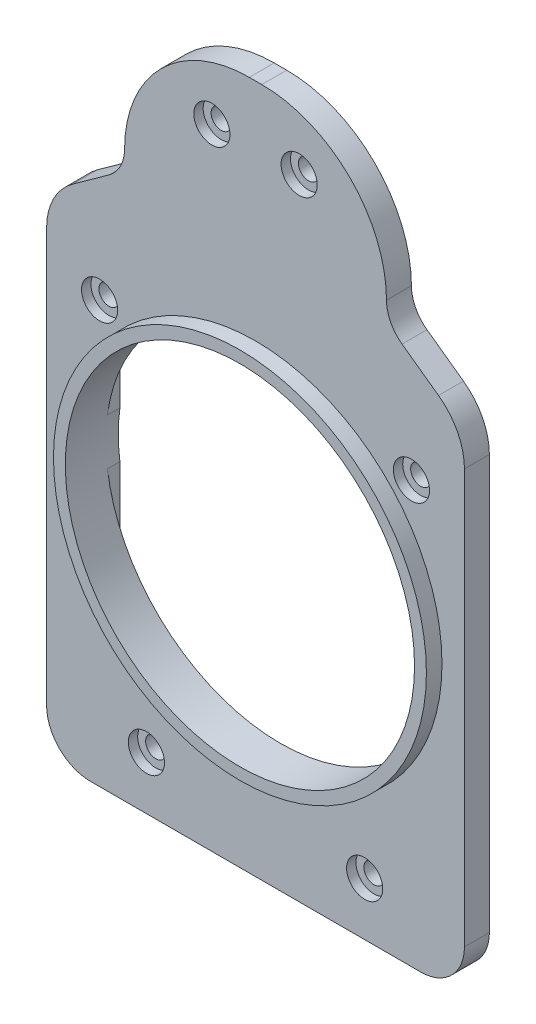
from build123d import *

# Parameters (mm, degrees)
ESBO_O1_W                = 67
ESBO_O1_H                = 110.5
RESSALTO_EXTRUS_O1_DEPTH = 4
CORTE_EXTRUS_O4_DEPTH    = 75.123208241
FILETE5_R                = 7
FILETE6_R                = 10
FILETE7_R                = 6
FILETE8_R                = 20
RESSALTO_EXTRUS_O2_DEPTH = 2
ESBO_O14_R               = 1.625
CORTE_EXTRUS_O5_DEPTH    = 75.257996336
ESBO_O15_R               = 2.9
CORTE_EXTRUS_O6_DEPTH    = 1.5
ESBO_O16_W               = 17
ESBO_O16_H               = 8
ESBO_O16_W_2             = 8
ESBO_O16_H_2             = 17
ESBO_O16_H_3             = 13.641135794
CORTE_EXTRUS_O7_DEPTH    = 75.123208381
ESBO_O18_R               = 29.9
ESBO_O18_R_2             = 28
RESSALTO_EXTRUS_O3_DEPTH = 2.5
ESBO_O19_R               = 28
CORTE_EXTRUS_O8_DEPTH    = 75.257996336
CORTE_EXTRUS_O9_DEPTH    = 3.5
FILETE9_R                = 0.5


with BuildPart() as part:
    # Esboço1 → Ressalto-extrusão1 (new body)
    with BuildSketch(Plane.XY):
        with Locations((0, 10.75)):
            Rectangle(ESBO_O1_W, ESBO_O1_H)
    extrude(amount=RESSALTO_EXTRUS_O1_DEPTH)

    # Esboço12 → Corte-extrusão4 (cut, through all)
    with BuildSketch(Plane.XY.offset(4)):
        Polygon((-33.5, 66), (-21, 66), (-21, 43), (-33.5, 34), align=None)
        Polygon((33.5, 66), (33.5, 34), (21, 43), (21, 66), align=None)
    extrude(amount=-CORTE_EXTRUS_O4_DEPTH, mode=Mode.SUBTRACT)

    # Filete5
    filete5_edges = [part.edges().sort_by_distance(p)[0] for p in [
        (33.5, -44.5, 2),
        (-33.5, -44.5, 2),
    ]]
    fillet(filete5_edges, radius=FILETE5_R)

    # Filete6
    filete6_edges = [part.edges().sort_by_distance(p)[0] for p in [
        (33.5, 34, 2),
        (-33.5, 34, 2),
    ]]
    fillet(filete6_edges, radius=FILETE6_R)

    # Filete7
    filete7_edges = [part.edges().sort_by_distance(p)[0] for p in [
        (-21, 43, 2),
        (21, 43, 2),
    ]]
    fillet(filete7_edges, radius=FILETE7_R)

    # Filete8
    filete8_edges = [part.edges().sort_by_distance(p)[0] for p in [
        (21, 66, 2),
        (-21, 66, 2),
    ]]
    fillet(filete8_edges, radius=FILETE8_R)

    # Esboço13 → Ressalto-extrusão2 (add)
    with BuildSketch(Plane(origin=(0, 0, 0), x_dir=(-1, 0, 0), z_dir=(0, 0, -1))):
        with BuildLine():
            Line((1.000103614, 61.75), (-1.000103614, 61.75))
            ThreePointArc((-1.000103614, 61.75), (-12.121303571, 57.152641459), (-16.750040848, 46.044464954))
            ThreePointArc((-16.750040848, 46.044464954), (-17.883803923, 41.387522709), (-21.01087656, 37.755175464))
            Line((-21.01087656, 37.755175464), (-26.859752174, 33.543985023))
            ThreePointArc((-26.859752174, 33.543985023), (-28.617669147, 31.499105387), (-29.25, 28.877662559))
            Line((-29.25, 28.877662559), (-29.25, -37.5))
            ThreePointArc((-29.25, -37.5), (-28.444543648, -39.444543648), (-26.5, -40.25))
            Line((-26.5, -40.25), (26.5, -40.25))
            ThreePointArc((26.5, -40.25), (28.444543648, -39.444543648), (29.25, -37.5))
            Line((29.25, -37.5), (29.25, 28.877662559))
            ThreePointArc((29.25, 28.877662559), (28.617669147, 31.499105387), (26.859752174, 33.543985023))
            Line((26.859752174, 33.543985023), (21.01087656, 37.755175464))
            ThreePointArc((21.01087656, 37.755175464), (17.883803923, 41.387522709), (16.750040848, 46.044464954))
            ThreePointArc((16.750040848, 46.044464954), (12.121303571, 57.152641459), (1.000103614, 61.75))
        make_face()
        with BuildLine():
            Line((1.000103614, 60.25), (-1.000103614, 60.25))
            ThreePointArc((-1.000103614, 60.25), (-11.06214167, 56.09048513), (-15.250046826, 46.040230197))
            ThreePointArc((-15.250046826, 46.040230197), (-16.549726448, 40.701784208), (-20.134419471, 36.537873952))
            Line((-20.134419471, 36.537873952), (-25.983295085, 32.326683511))
            ThreePointArc((-25.983295085, 32.326683511), (-27.282625022, 30.815250737), (-27.75, 28.877662559))
            Line((-27.75, 28.877662559), (-27.75, -37.5))
            ThreePointArc((-27.75, -37.5), (-27.383883476, -38.383883476), (-26.5, -38.75))
            Line((-26.5, -38.75), (26.5, -38.75))
            ThreePointArc((26.5, -38.75), (27.383883476, -38.383883476), (27.75, -37.5))
            Line((27.75, -37.5), (27.75, 28.877662559))
            ThreePointArc((27.75, 28.877662559), (27.282625022, 30.815250737), (25.983295085, 32.326683511))
            Line((25.983295085, 32.326683511), (20.134419471, 36.537873952))
            ThreePointArc((20.134419471, 36.537873952), (16.549726448, 40.701784208), (15.250046826, 46.040230197))
            ThreePointArc((15.250046826, 46.040230197), (11.06214167, 56.09048513), (1.000103614, 60.25))
        make_face(mode=Mode.SUBTRACT)
    extrude(amount=RESSALTO_EXTRUS_O2_DEPTH)

    # Esboço14 → Corte-extrusão5 (cut, through all)
    with BuildSketch(Plane.XY.offset(4)):
        with Locations((-7, 56.5)):
            Circle(ESBO_O14_R)
        with Locations((-25, 23.08)):
            Circle(ESBO_O14_R)
        with Locations((-17.5, -36)):
            Circle(ESBO_O14_R)
        with Locations((17.5, -36)):
            Circle(ESBO_O14_R)
        with Locations((25, 23.08)):
            Circle(ESBO_O14_R)
        with Locations((7, 56.5)):
            Circle(ESBO_O14_R)
    extrude(amount=-CORTE_EXTRUS_O5_DEPTH, mode=Mode.SUBTRACT)

    # Esboço15 → Corte-extrusão6 (cut)
    with BuildSketch(Plane.XY.offset(4)):
        with Locations((-7, 56.5)):
            Circle(ESBO_O15_R)
        with Locations((-25, 23.08)):
            Circle(ESBO_O15_R)
        with Locations((-17.5, -36)):
            Circle(ESBO_O15_R)
        with Locations((17.5, -36)):
            Circle(ESBO_O15_R)
        with Locations((25, 23.08)):
            Circle(ESBO_O15_R)
        with Locations((7, 56.5)):
            Circle(ESBO_O15_R)
    extrude(amount=-CORTE_EXTRUS_O6_DEPTH, mode=Mode.SUBTRACT)

    # Esboço16 → Corte-extrusão7 (cut, through all)
    with BuildSketch(Plane(origin=(0, 0, 0), x_dir=(-1, 0, 0), z_dir=(0, 0, -1))):
        with Locations((-25, 23.08)):
            Rectangle(ESBO_O16_W, ESBO_O16_H)
        with Locations((-17.5, -36)):
            Rectangle(ESBO_O16_W_2, ESBO_O16_H_2)
        with Locations((-7, 56.5)):
            Rectangle(ESBO_O16_W_2, ESBO_O16_H_3)
        with Locations((7, 56.5)):
            Rectangle(ESBO_O16_W_2, ESBO_O16_H_3)
        with Locations((17.5, -36)):
            Rectangle(ESBO_O16_W_2, ESBO_O16_H_2)
        with Locations((25, 23.08)):
            Rectangle(ESBO_O16_W, ESBO_O16_H)
    extrude(amount=CORTE_EXTRUS_O7_DEPTH, mode=Mode.SUBTRACT)

    # Esboço18 → Ressalto-extrusão3 (add)
    with BuildSketch(Plane.XY.offset(4)):
        Circle(ESBO_O18_R)
        Circle(ESBO_O18_R_2, mode=Mode.SUBTRACT)
    extrude(amount=RESSALTO_EXTRUS_O3_DEPTH)

    # Esboço19 → Corte-extrusão8 (cut, through all)
    with BuildSketch(Plane.XY.offset(4)):
        Circle(ESBO_O19_R)
    extrude(amount=-CORTE_EXTRUS_O8_DEPTH, mode=Mode.SUBTRACT)

    # Esboço20 → Corte-extrusão9 (cut)
    with BuildSketch(Plane(origin=(0, 0, 0), x_dir=(-1, 0, 0), z_dir=(0, 0, -1))):
        with BuildLine():
            Line((-21, 21.424285286), (-21, 31.022164122))
            Line((-21, 31.022164122), (-3.637351988, 49.43069534))
            ThreePointArc((-3.637351988, 49.43069534), (0, 51), (3.637351988, 49.43069534))
            Line((3.637351988, 49.43069534), (21, 31.022164122))
            Line((21, 31.022164122), (21, 21.424285286))
            ThreePointArc((21, 21.424285286), (0, 30), (-21, 21.424285286))
        make_face()
    extrude(amount=-CORTE_EXTRUS_O9_DEPTH, mode=Mode.SUBTRACT)

    # Filete9
    filete9_edges = [part.edges().sort_by_distance(p)[0] for p in [
        (21, 31.022164122, 1.75),
        (-21, 31.022164122, 1.75),
        (-21, 21.424285286, 1.75),
        (21, 21.424285286, 1.75),
    ]]
    fillet(filete9_edges, radius=FILETE9_R)


solid = part.part
